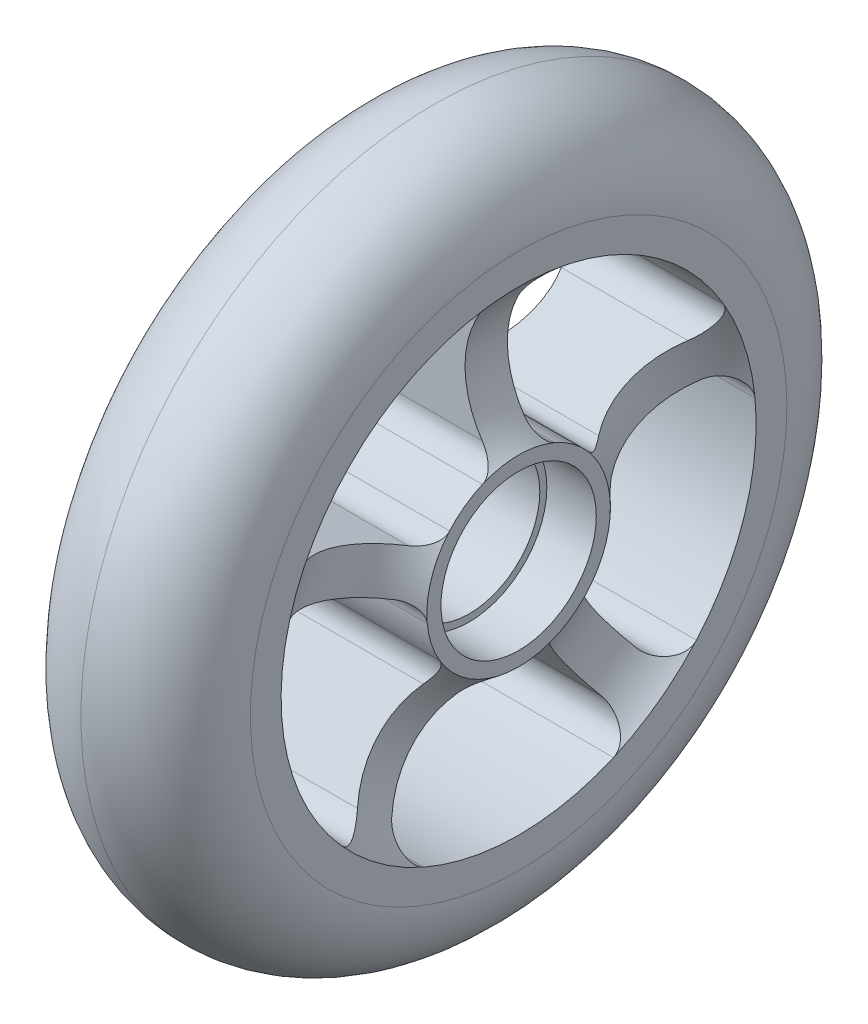
from build123d import *

# Parameters (mm, degrees)
IZIM1_R                          = 49.999387971
IZIM1_R_2                        = 36.141228797
IZIM1_R_3                        = 11
Y_KSEKLIK_EKSTR_ZYON1_DEPTH      = 24
RADYUS1_R                        = 3.5
RADYUS2_R                        = 12
Y_KSEKLIK_EKSTR_ZYON2_DEPTH      = 5
Y_KSEKLIK_EKSTR_ZYON2_DEPTH_BACK = 5
IZIM4_R                          = 11
IZIM4_R_2                        = 10


with BuildPart() as part:
    # Çizim1 → Yükseklik-Ekstrüzyon1 (new body)
    # profile 1 of 2: a face of its own
    with BuildSketch(Plane(origin=(0, 0, 0), x_dir=(0, 0, -1), z_dir=(1, 0, 0))):
        Circle(IZIM1_R)
        Circle(IZIM1_R_2, mode=Mode.SUBTRACT)
    # profile 2 of 2: a face of its own
    with BuildSketch(Plane(origin=(0, 0, 0), x_dir=(0, 0, -1), z_dir=(1, 0, 0))):
        Circle(IZIM1_R_2)
        Circle(IZIM1_R_3, mode=Mode.SUBTRACT)
        with BuildLine():
            Line((11.102968117, 6.761959701), (30.94018741, 13.207462967))
            ThreePointArc((30.94018741, 13.207462967), (19.773818156, 27.216325808), (3, 33.507197361))
            Line((3, 33.507197361), (3, 12.649110641))
            ThreePointArc((3, 12.649110641), (7.64120828, 10.517220927), (11.102968117, 6.761959701))
        make_face(mode=Mode.SUBTRACT)
        with BuildLine():
            ThreePointArc((-32.794289376, 7.501123869), (-31.994709864, -10.39571141), (-22.122087437, -25.344536342))
            Line((-22.122087437, -25.344536342), (-9.862011672, -8.469989715))
            ThreePointArc((-9.862011672, -8.469989715), (-12.363734712, -4.017220927), (-12.957070083, 1.055620603))
            Line((-12.957070083, 1.055620603), (-32.794289376, 7.501123869))
        make_face(mode=Mode.SUBTRACT)
        with BuildLine():
            ThreePointArc((-17.267985471, -28.871247856), (0, -33.641228797), (17.267985471, -28.871247856))
            Line((17.267985471, -28.871247856), (5.007909706, -11.996701229))
            ThreePointArc((5.007909706, -11.996701229), (0, -13), (-5.007909706, -11.996701229))
            Line((-5.007909706, -11.996701229), (-17.267985471, -28.871247856))
        make_face(mode=Mode.SUBTRACT)
        with BuildLine():
            Line((9.862011672, -8.469989715), (22.122087437, -25.344536342))
            ThreePointArc((22.122087437, -25.344536342), (31.994709864, -10.39571141), (32.794289376, 7.501123869))
            Line((32.794289376, 7.501123869), (12.957070083, 1.055620603))
            ThreePointArc((12.957070083, 1.055620603), (12.363734712, -4.017220927), (9.862011672, -8.469989715))
        make_face(mode=Mode.SUBTRACT)
        with BuildLine():
            Line((-3, 12.649110641), (-3, 33.507197361))
            ThreePointArc((-3, 33.507197361), (-19.773818156, 27.216325808), (-30.94018741, 13.207462967))
            Line((-30.94018741, 13.207462967), (-11.102968117, 6.761959701))
            ThreePointArc((-11.102968117, 6.761959701), (-7.64120828, 10.517220927), (-3, 12.649110641))
        make_face(mode=Mode.SUBTRACT)
    extrude(amount=Y_KSEKLIK_EKSTR_ZYON1_DEPTH)

    # Radyus1
    radyus1_edges = [part.edges().sort_by_distance(p)[0] for p in [
        (12, 33.507197361, 3),
        (12, 13.207462967, 30.94018741),
        (12, 6.761959701, 11.102968117),
        (12, 12.649110641, 3),
        (12, -25.344536342, -22.122087437),
        (12, 7.501123869, -32.794289376),
        (12, 1.055620603, -12.957070083),
        (12, -8.469989715, -9.862011672),
        (12, -28.871247856, -17.267985471),
        (12, -11.996701229, -5.007909706),
        (12, -11.996701229, 5.007909706),
        (12, -28.871247856, 17.267985471),
        (12, -25.344536342, 22.122087437),
        (12, -8.469989715, 9.862011672),
        (12, 1.055620603, 12.957070083),
        (12, 7.501123869, 32.794289376),
        (12, 13.207462967, -30.94018741),
        (12, 33.507197361, -3),
        (12, 12.649110641, -3),
        (12, 6.761959701, -11.102968117),
    ]]
    fillet(radyus1_edges, radius=RADYUS1_R)

    # Çizim3 → Kes-Döndür4 (revolve, cut)
    with BuildSketch(Plane.XY):
        with BuildLine():
            Line((0, -13), (0, -33.641228797))
            ThreePointArc((0, -33.641228797), (4.42389387, -23.320614398), (0, -13))
        make_face()
        with BuildLine():
            Line((24, -33.641228797), (24, -13))
            ThreePointArc((24, -13), (19.405307354, -23.320614398), (24, -33.641228797))
        make_face()
    revolve(axis=Axis((-73.294159786, 0, 0), (1, 0, 0)), mode=Mode.SUBTRACT)

    # Radyus2
    radyus2_edges = [part.edges().sort_by_distance(p)[0] for p in [
        (0, 0, 49.999387971),
        (24, 0, 49.999387971),
    ]]
    fillet(radyus2_edges, radius=RADYUS2_R - 0.0001)  # a hair under: the kernel refuses the full size


with BuildPart() as body_2:
    # Çizim4 → Yükseklik-Ekstrüzyon2 (new, two sides: drawn at the far end of the back side and taken through both)
    with BuildSketch(Plane(origin=(12, 0, 0), x_dir=(0, 0, -1), z_dir=(1, 0, 0)).offset(-Y_KSEKLIK_EKSTR_ZYON2_DEPTH_BACK)):
        Circle(IZIM4_R)
        Circle(IZIM4_R_2, mode=Mode.SUBTRACT)
    extrude(amount=Y_KSEKLIK_EKSTR_ZYON2_DEPTH + Y_KSEKLIK_EKSTR_ZYON2_DEPTH_BACK)


solid = Compound([part.part, body_2.part])
